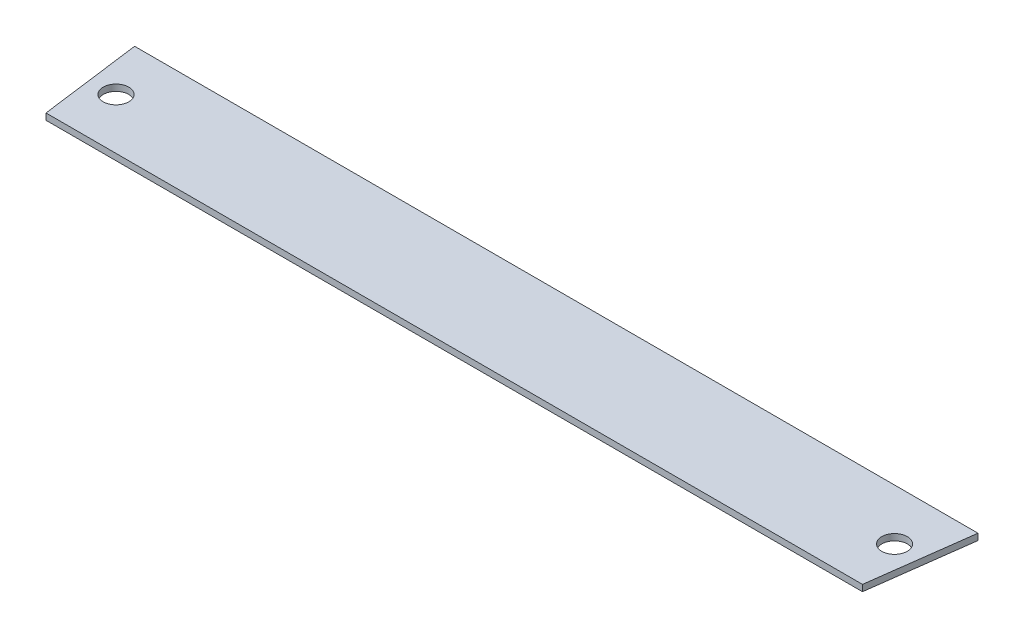
from build123d import *

# Parameters (mm, degrees)
SKETCH1_R           = 6.35
BOSS_EXTRUDE1_DEPTH = 3.175


with BuildPart() as part:
    # Sketch1 → Boss-Extrude1 (new body)
    with BuildSketch(Plane(origin=(0, 0, 0), x_dir=(1, 0, 0), z_dir=(0, 1, 0))):
        Polygon((-203.2, -25.4), (203.2, -25.4), (209.887946877, 25.4), (-209.887946877, 25.4), align=None)
        with Locations((-193.75, 0)):
            Circle(SKETCH1_R, mode=Mode.SUBTRACT)
        with Locations((193.75, 0)):
            Circle(SKETCH1_R, mode=Mode.SUBTRACT)
    extrude(amount=BOSS_EXTRUDE1_DEPTH)


solid = part.part
